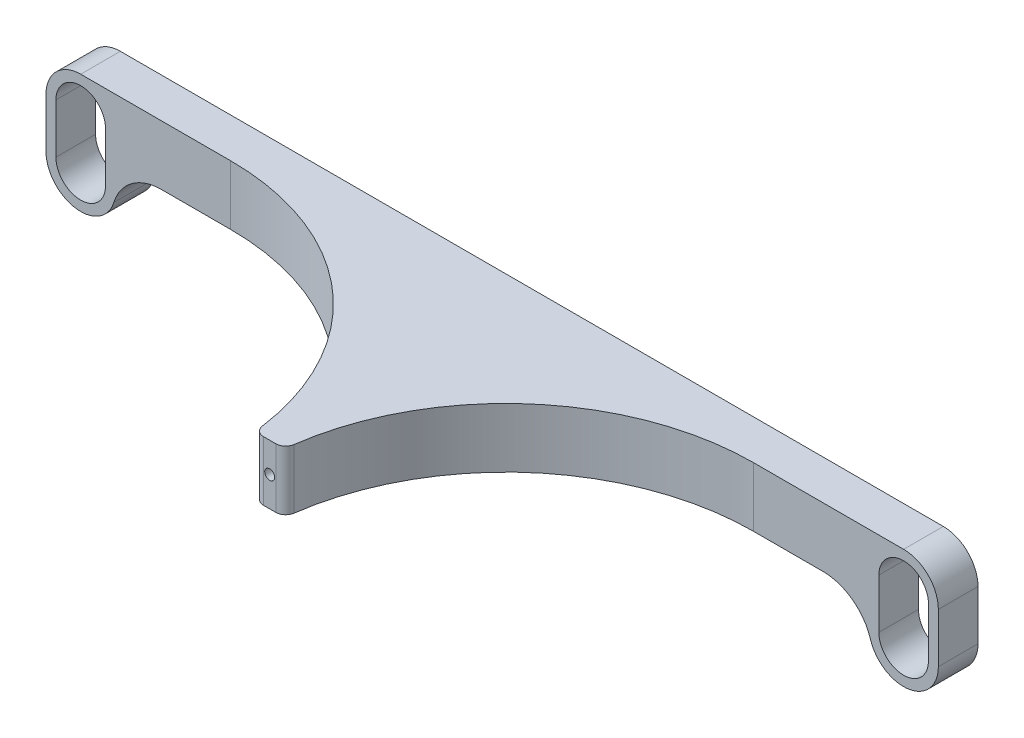
from build123d import *

# Parameters (mm, degrees)
SALIENTE_EXTRUIR1_DEPTH = 4
REDONDEO1_R             = 5
CROQUIS2_W              = 3
CROQUIS2_H              = 6
SALIENTE_EXTRUIR2_DEPTH = 22.44
REDONDEO2_R             = 25
CROQUIS3_R              = 0.5
CORTAR_EXTRUIR1_DEPTH   = 2
REDONDEO3_R             = 1


with BuildPart() as part:
    # Croquis1 → Saliente-Extruir1 (new body)
    # profile 1 of 4: a face of its own
    with BuildSketch(Plane.XY):
        with BuildLine():
            Line((-38, -3.5), (-38, -8.5))
            ThreePointArc((-38, -8.5), (-41.5, -12), (-45, -8.5))
            Line((-45, -8.5), (-45, -3.5))
            ThreePointArc((-45, -3.5), (-41.5, 0), (-38, -3.5))
        make_face()
        with BuildLine():
            ThreePointArc((-44, -8.5), (-41.5, -11), (-39, -8.5))
            Line((-39, -8.5), (-39, -3.5))
            ThreePointArc((-39, -3.5), (-41.5, -1), (-44, -3.5))
            Line((-44, -3.5), (-44, -8.5))
        make_face(mode=Mode.SUBTRACT)
    # profile 2 of 4: a face of its own
    with BuildSketch(Plane.XY):
        with BuildLine():
            Line((0, 0), (-41.5, 0))
            ThreePointArc((-41.5, 0), (-39.025126266, -1.025126266), (-38, -3.5))
            Line((-38, -3.5), (-38, -6))
            Line((-38, -6), (0, -6))
            Line((0, -6), (0, 0))
        make_face()
    # profile 3 of 4: a face of its own
    with BuildSketch(Plane.XY):
        with BuildLine():
            Line((41.5, 0), (0, 0))
            Line((0, 0), (0, -6))
            Line((0, -6), (38, -6))
            Line((38, -6), (38, -3.5))
            ThreePointArc((38, -3.5), (39.025126266, -1.025126266), (41.5, 0))
        make_face()
    # profile 4 of 4: a face of its own
    with BuildSketch(Plane.XY):
        with BuildLine():
            ThreePointArc((45, -8.5), (41.5, -12), (38, -8.5))
            Line((38, -8.5), (38, -3.5))
            ThreePointArc((38, -3.5), (41.5, 0), (45, -3.5))
            Line((45, -3.5), (45, -8.5))
        make_face()
        with BuildLine():
            Line((39, -3.5), (39, -8.5))
            ThreePointArc((39, -8.5), (41.5, -11), (44, -8.5))
            Line((44, -8.5), (44, -3.5))
            ThreePointArc((44, -3.5), (41.5, -1), (39, -3.5))
        make_face(mode=Mode.SUBTRACT)
    extrude(amount=SALIENTE_EXTRUIR1_DEPTH)

    # Redondeo1
    redondeo1_edges = [part.edges().sort_by_distance(p)[0] for p in [
        (38, -6, 2),
        (-38, -6, 2),
    ]]
    fillet(redondeo1_edges, radius=REDONDEO1_R)

    # Croquis2 → Saliente-Extruir2 (add)
    with BuildSketch(Plane.XY.offset(4)):
        with Locations((0, -3)):
            Rectangle(CROQUIS2_W, CROQUIS2_H)
    extrude(amount=SALIENTE_EXTRUIR2_DEPTH)

    # Redondeo2
    # the kernel refuses this fillet: 25 mm, written as the material it adds along each edge
    with BuildSketch(Plane(origin=(1.5, -6, 4), x_dir=(1, 0, 0), z_dir=(0, 1, 0)), Plane(origin=(-1.5, 0, 4), x_dir=(-1, 0, 0), z_dir=(0, -1, 0))) as redondeo2_piece_1:
        with BuildLine():
            CenterArc((24.868582589, -25), REDONDEO2_R, 90, 84.122610013)
            Line((0, -22.44), (-0.497371652, -22.3888))
            ThreePointArc((-0.497371652, -22.3888), (-0.5, -11.22), (-0.5, 0))
            Line((-0.5, 0), (0, 0.5))
            Line((0, 0.5), (24.868582589, 0.5))
            Line((24.868582589, 0.5), (24.868582589, 0))
        make_face()
    extrude(amount=6)

    # Croquis3 → Cortar-Extruir1 (cut)
    with BuildSketch(Plane.XY.offset(26.44)):
        with Locations((0, -3)):
            Circle(CROQUIS3_R)
    extrude(amount=-CORTAR_EXTRUIR1_DEPTH, mode=Mode.SUBTRACT)

    # Redondeo3
    redondeo3_edges = [part.edges().sort_by_distance(p)[0] for p in [
        (-1.5, -3, 26.44),
        (1.5, -3, 26.44),
    ]]
    fillet(redondeo3_edges, radius=REDONDEO3_R)


solid = part.part
